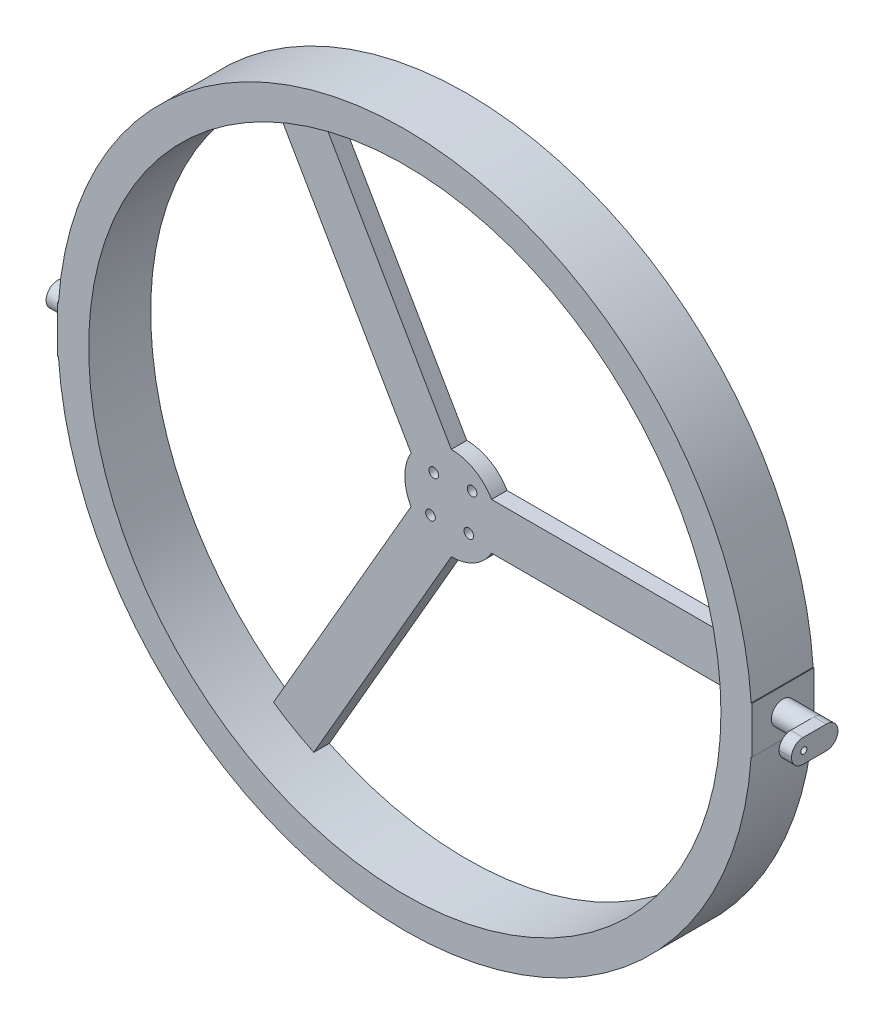
from build123d import *

# Parameters (mm, degrees)
BOSS_EXTRUDE1_DEPTH = 20
SKETCH1_3_R         = 15
BOSS_EXTRUDE2_DEPTH = 5
SKETCH2_R           = 1.55
CUT_EXTRUDE1_DEPTH  = 5
SKETCH4_R           = 3.75
BOSS_EXTRUDE3_DEPTH = 10
BOSS_EXTRUDE4_START = 10
SKETCH3_R           = 3.75
BOSS_EXTRUDE4_DEPTH = 10
SKETCH5_W           = 15
SKETCH5_H           = 7.5
BOSS_EXTRUDE5_DEPTH = 4
FILLET2_R           = 3.75
SKETCH6_R           = 1
CUT_EXTRUDE2_DEPTH  = 4


with BuildPart() as part:
    # Sketch1 → Boss-Extrude1 (new body)
    with BuildSketch(Plane.XY):
        with BuildLine():
            Line((112, 7.5), (111.748601781, 7.5))
            ThreePointArc((111.748601781, 7.5), (0, 112), (-111.748601781, 7.5))
            Line((-111.748601781, 7.5), (-112, 7.5))
            Line((-112, 7.5), (-112, -7.5))
            Line((-112, -7.5), (-111.748601781, -7.5))
            ThreePointArc((-111.748601781, -7.5), (0, -112), (111.748601781, -7.5))
            Line((111.748601781, -7.5), (112, -7.5))
            Line((112, -7.5), (112, 7.5))
        make_face()
        with BuildLine():
            ThreePointArc((102, 0), (101.930949377, -3.752540346), (101.723890999, -7.5))
            ThreePointArc((101.723890999, -7.5), (51, -88.334591186), (-44.366754971, -91.845473777))
            ThreePointArc((-44.366754971, -91.845473777), (-51, -88.334591186), (-57.357136028, -84.345473777))
            ThreePointArc((-57.357136028, -84.345473777), (-102, 0), (-57.357136028, 84.345473777))
            ThreePointArc((-57.357136028, 84.345473777), (-51, 88.334591186), (-44.366754971, 91.845473777))
            ThreePointArc((-44.366754971, 91.845473777), (51, 88.334591186), (101.723890999, 7.5))
            ThreePointArc((101.723890999, 7.5), (101.930949377, 3.752540346), (102, 0))
        make_face(mode=Mode.SUBTRACT)
    extrude(amount=BOSS_EXTRUDE1_DEPTH)

    # Sketch1<3> → Boss-Extrude2 (add)
    with BuildSketch(Plane.XY):
        with BuildLine():
            Line((-57.357136028, 84.345473777), (-12.990381057, 7.5))
            ThreePointArc((-12.990381057, 7.5), (-7.5, 12.990381057), (0, 15))
            Line((0, 15), (-44.366754971, 91.845473777))
            ThreePointArc((-44.366754971, 91.845473777), (-51, 88.334591186), (-57.357136028, 84.345473777))
        make_face()
        Circle(SKETCH1_3_R)
        with BuildLine():
            Line((-44.366754971, -91.845473777), (0, -15))
            ThreePointArc((0, -15), (-7.5, -12.990381057), (-12.990381057, -7.5))
            Line((-12.990381057, -7.5), (-57.357136028, -84.345473777))
            ThreePointArc((-57.357136028, -84.345473777), (-51, -88.334591186), (-44.366754971, -91.845473777))
        make_face()
        with BuildLine():
            ThreePointArc((15, 0), (14.488887394, -3.882285677), (12.990381057, -7.5))
            Line((12.990381057, -7.5), (101.723890999, -7.5))
            ThreePointArc((101.723890999, -7.5), (101.930949377, -3.752540346), (102, 0))
            ThreePointArc((102, 0), (101.930949377, 3.752540346), (101.723890999, 7.5))
            Line((101.723890999, 7.5), (12.990381057, 7.5))
            ThreePointArc((12.990381057, 7.5), (14.488887394, 3.882285677), (15, 0))
        make_face()
    extrude(amount=BOSS_EXTRUDE2_DEPTH)

    # Sketch2 → Cut-Extrude1 (cut)
    with BuildSketch(Plane.XY.offset(5)):
        with Locations((-5.656854249, 5.656854249)):
            Circle(SKETCH2_R)
        with Locations((6.717514421, 6.717514421)):
            Circle(SKETCH2_R)
        with Locations((5.656854249, -5.656854249)):
            Circle(SKETCH2_R)
        with Locations((-6.717514421, -6.717514421)):
            Circle(SKETCH2_R)
    extrude(amount=-CUT_EXTRUDE1_DEPTH, mode=Mode.SUBTRACT)

    # Sketch4 → Boss-Extrude3 (add)
    with BuildSketch(Plane.ZY.offset(112)):
        with Locations(Location((10, 0, 0), (0, 0, 180))):
            Circle(SKETCH4_R)
    extrude(amount=BOSS_EXTRUDE3_DEPTH)

    # Sketch3 → Boss-Extrude4 (add)
    with BuildSketch(Plane(origin=(112, 0, 0), x_dir=(0, 0, -1), z_dir=(1, 0, 0)).offset(BOSS_EXTRUDE4_START)):
        with Locations((-10, 0)):
            Circle(SKETCH3_R)
    extrude(amount=-BOSS_EXTRUDE4_DEPTH)

    # Sketch5 → Boss-Extrude5 (add)
    with BuildSketch(Plane(origin=(122, 0, 0), x_dir=(0, 0, -1), z_dir=(1, 0, 0))):
        with Locations((-13.75, 0)):
            Rectangle(SKETCH5_W, SKETCH5_H)
    extrude(amount=BOSS_EXTRUDE5_DEPTH)

    # Fillet2
    fillet2_edges = [part.edges().sort_by_distance(p)[0] for p in [
        (124, -3.75, 21.25),
        (124, 3.75, 21.25),
        (124, 3.75, 6.25),
        (124, -3.75, 6.25),
    ]]
    fillet(fillet2_edges, radius=FILLET2_R - 0.0001)  # a hair under: the kernel refuses the full size

    # Sketch6 → Cut-Extrude2 (cut)
    with BuildSketch(Plane(origin=(126, 0, 0), x_dir=(0, 0, -1), z_dir=(1, 0, 0))):
        with Locations((-17.25, 0)):
            Circle(SKETCH6_R)
    extrude(amount=-CUT_EXTRUDE2_DEPTH, mode=Mode.SUBTRACT)


solid = part.part
